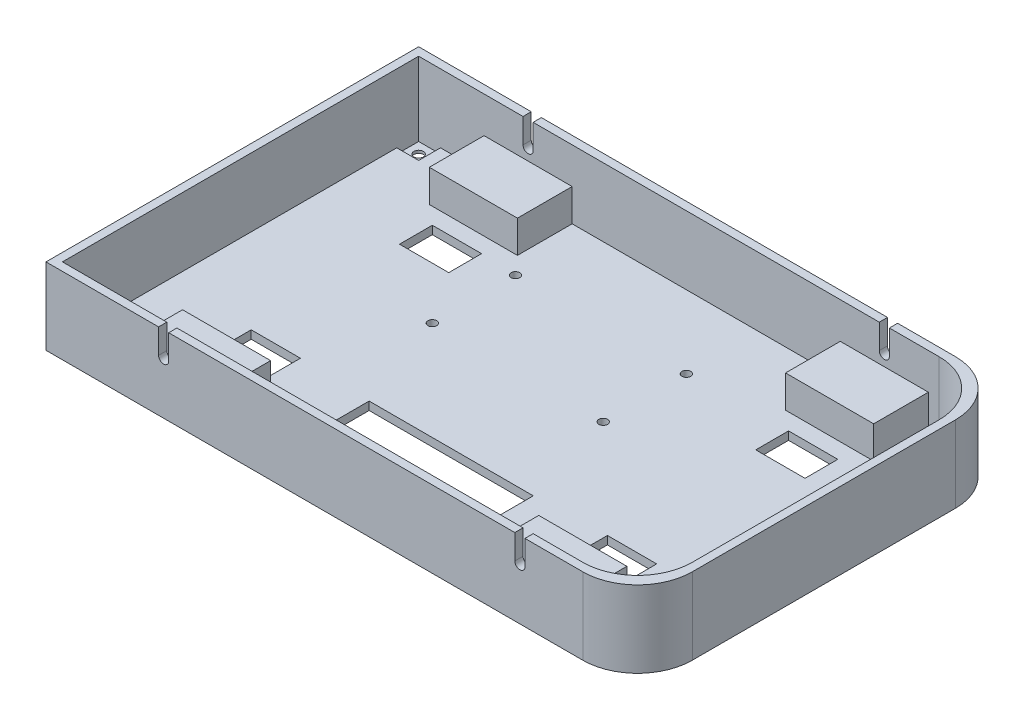
from build123d import *

# Parameters (mm, degrees)
SKETCH1_W                = 210.2
SKETCH1_H                = 130.2
BOSS_EXTRUDE1_DEPTH      = 3
FILLET1_R                = 20
BOSS_EXTRUDE3_DEPTH      = 25
BOSS_EXTRUDE3_DEPTH_BACK = 3
SKETCH2_W                = 216.2
SKETCH2_H                = 136.2
SKETCH2_W_2              = 210.2
SKETCH2_H_2              = 130.2
FILLET2_START            = -1
FILLET2_DEPTH            = 29
FILLET2_2_DEPTH          = 28
SKETCH5_W                = 32.2
SKETCH5_H                = 20
BOSS_EXTRUDE4_DEPTH      = 11.8
MIRROR2_COPY_1_SKETCH_W  = 32.2
MIRROR2_COPY_1_SKETCH_H  = 20
MIRROR2_COPY_1_DEPTH     = 11.8
SKETCH4_W                = 3.7
SKETCH4_H                = 167.196709826
SKETCH4_H_2              = 176.392528866
CUT_EXTRUDE1_DEPTH       = 9
CROQUIS1_R               = 1.75
CORTAR_EXTRUIR1_DEPTH    = 5
CROQUIS2_W               = 18
CROQUIS2_H               = 12
CROQUIS2_W_2             = 60
CORTAR_EXTRUIR2_DEPTH    = 5
CROQUIS3_W               = 8
CROQUIS3_H               = 8
CORTAR_EXTRUIR3_DEPTH    = 2
CORTAR_EXTRUIR4_DEPTH    = 150
CROQUIS5_R               = 1.6
CORTAR_EXTRUIR5_DEPTH    = 10


with BuildPart() as part:
    # Sketch1 → Boss-Extrude1 (new body)
    with BuildSketch(Plane(origin=(0, 0, 0), x_dir=(1, 0, 0), z_dir=(0, 1, 0))):
        Rectangle(SKETCH1_W, SKETCH1_H)
    extrude(amount=BOSS_EXTRUDE1_DEPTH)

    # Fillet1
    fillet1_edges = [part.edges().sort_by_distance(p)[0] for p in [
        (105.1, 1.5, 65.1),
        (105.1, 1.5, -65.1),
    ]]
    fillet(fillet1_edges, radius=FILLET1_R)

    # Sketch2 → Boss-Extrude3 (add, two sides: drawn at the far end of the back side and taken through both)
    with BuildSketch(Plane(origin=(0, 3, 0), x_dir=(1, 0, 0), z_dir=(0, 1, 0)).offset(-BOSS_EXTRUDE3_DEPTH_BACK)):
        Rectangle(SKETCH2_W, SKETCH2_H)
        Rectangle(SKETCH2_W_2, SKETCH2_H_2, mode=Mode.SUBTRACT)
    extrude(amount=BOSS_EXTRUDE3_DEPTH + BOSS_EXTRUDE3_DEPTH_BACK)

    # Fillet2: read off the stored shape, not the designer's step
    # Fillet2 outline → Fillet2 (cut)
    with BuildSketch(Plane(origin=(0, 0, 0), x_dir=(1, 0, 0), z_dir=(0, 1, 0)).offset(FILLET2_START)):
        with BuildLine():
            ThreePointArc((98.635653754, -65.1), (93.577225575, -67.335384062), (88.1, -68.1))
            Line((88.1, -68.1), (108.1, -68.1))
            Line((108.1, -68.1), (108.1, -48.1))
            ThreePointArc((108.1, -48.1), (107.335384062, -53.577225575), (105.1, -58.635653754))
            Line((105.1, -58.635653754), (105.1, -65.1))
            Line((105.1, -65.1), (98.635653754, -65.1))
        make_face()
        with BuildLine():
            ThreePointArc((105.1, 58.635653754), (107.335384062, 53.577225575), (108.1, 48.1))
            Line((108.1, 48.1), (108.1, 68.1))
            Line((108.1, 68.1), (88.1, 68.1))
            ThreePointArc((88.1, 68.1), (93.577225575, 67.335384062), (98.635653754, 65.1))
            Line((98.635653754, 65.1), (105.1, 65.1))
            Line((105.1, 65.1), (105.1, 58.635653754))
        make_face()
    extrude(amount=FILLET2_DEPTH, mode=Mode.SUBTRACT)

    # Fillet2 2 outline → Fillet2 2 (add)
    with BuildSketch(Plane(origin=(0, 0, 0), x_dir=(1, 0, 0), z_dir=(0, 1, 0))):
        with BuildLine():
            Line((85.1, -65.1), (98.635653754, -65.1))
            ThreePointArc((98.635653754, -65.1), (102.242135624, -62.242135624), (105.1, -58.635653754))
            Line((105.1, -58.635653754), (105.1, -45.1))
            ThreePointArc((105.1, -45.1), (99.242135624, -59.242135624), (85.1, -65.1))
        make_face()
        with BuildLine():
            ThreePointArc((85.1, 65.1), (99.242135624, 59.242135624), (105.1, 45.1))
            Line((105.1, 45.1), (105.1, 58.635653754))
            ThreePointArc((105.1, 58.635653754), (102.242135624, 62.242135624), (98.635653754, 65.1))
            Line((98.635653754, 65.1), (85.1, 65.1))
        make_face()
    extrude(amount=FILLET2_2_DEPTH)

    # Sketch5 → Boss-Extrude4 (add)
    with BuildSketch(Plane(origin=(0, 3, 0), x_dir=(1, 0, 0), z_dir=(0, 1, 0))):
        with Locations((-65.1, 55.1)):
            Rectangle(SKETCH5_W, SKETCH5_H)
    boss_extrude4 = extrude(amount=BOSS_EXTRUDE4_DEPTH)

    # Mirror1: Boss-Extrude4 across plane
    add(boss_extrude4.mirror(Plane(origin=(0, 0, 0), x_dir=(0, 0, 1), z_dir=(1, 0, 0))))

    # Mirror2: Boss-Extrude4 across plane
    add(boss_extrude4.mirror(Plane.XY))

    # Mirror2 copy 1 sketch → Mirror2 copy 1 (add)
    with BuildSketch(Plane(origin=(0, 3, 0), x_dir=(-1, 0, 0), z_dir=(0, 1, 0))):
        with Locations((-65.1, 55.1)):
            Rectangle(MIRROR2_COPY_1_SKETCH_W, MIRROR2_COPY_1_SKETCH_H)
    extrude(amount=MIRROR2_COPY_1_DEPTH)

    # Sketch4 → Cut-Extrude1 (cut)
    with BuildSketch(Plane(origin=(0, 28, 0), x_dir=(1, 0, 0), z_dir=(0, 1, 0))):
        with Locations((-65.1, 0)):
            Rectangle(SKETCH4_W, SKETCH4_H)
        with Locations((65.1, 0)):
            Rectangle(SKETCH4_W, SKETCH4_H_2)
    extrude(amount=-CUT_EXTRUDE1_DEPTH, mode=Mode.SUBTRACT)

    # Croquis1 → Cortar-Extruir1 (cut)
    with BuildSketch(Plane.XZ):
        with Locations(Location((-101.1, 61.1, 0), (0, 0, 270))):
            Circle(CROQUIS1_R)
        with Locations(Location((-101.1, -61.1, 0), (0, 0, 270))):
            Circle(CROQUIS1_R)
        with Locations(Location((96.1, 56.1, 0), (0, 0, 270))):
            Circle(CROQUIS1_R)
        with Locations(Location((96.1, -56.1, 0), (0, 0, 270))):
            Circle(CROQUIS1_R)
    extrude(amount=-CORTAR_EXTRUIR1_DEPTH, mode=Mode.SUBTRACT)

    # Croquis2 → Cortar-Extruir2 (cut)
    with BuildSketch(Plane(origin=(0, 3, 0), x_dir=(1, 0, 0), z_dir=(0, 1, 0))):
        with Locations((-65.1, 33.1)):
            Rectangle(CROQUIS2_W, CROQUIS2_H)
        with Locations((-65.1, -33.1)):
            Rectangle(CROQUIS2_W, CROQUIS2_H)
        with Locations((65.1, 33.1)):
            Rectangle(CROQUIS2_W, CROQUIS2_H)
        with Locations((65.1, -33.1)):
            Rectangle(CROQUIS2_W, CROQUIS2_H)
        with Locations((0, -34.1)):
            Rectangle(CROQUIS2_W_2, CROQUIS2_H)
    extrude(amount=-CORTAR_EXTRUIR2_DEPTH, mode=Mode.SUBTRACT)

    # Croquis3 → Cortar-Extruir3 (cut)
    with BuildSketch(Plane(origin=(0, 3, 0), x_dir=(1, 0, 0), z_dir=(0, 1, 0))):
        with BuildLine():
            Line((92.1, 60.1), (96.9, 60.1))
            ThreePointArc((96.9, 60.1), (99.1627417, 59.1627417), (100.1, 56.9))
            Line((100.1, 56.9), (100.1, 52.1))
            Line((100.1, 52.1), (92.1, 52.1))
            Line((92.1, 52.1), (92.1, 60.1))
        make_face()
        with Locations((-101.1, 61.1)):
            Rectangle(CROQUIS3_W, CROQUIS3_H)
        with Locations((-101.1, -61.1)):
            Rectangle(CROQUIS3_W, CROQUIS3_H)
        with BuildLine():
            Line((92.1, -52.1), (100.1, -52.1))
            Line((100.1, -52.1), (100.1, -56.9))
            ThreePointArc((100.1, -56.9), (99.1627417, -59.1627417), (96.9, -60.1))
            Line((96.9, -60.1), (92.1, -60.1))
            Line((92.1, -60.1), (92.1, -52.1))
        make_face()
    extrude(amount=-CORTAR_EXTRUIR3_DEPTH, mode=Mode.SUBTRACT)

    # Croquis4 → Cortar-Extruir4 (cut)
    with BuildSketch(Plane.XY.offset(68.1)):
        with BuildLine():
            Line((-66.95, 19), (-63.25, 19))
            ThreePointArc((-63.25, 19), (-65.1, 17.15), (-66.95, 19))
        make_face()
        with BuildLine():
            Line((66.95, 19), (63.25, 19))
            ThreePointArc((63.25, 19), (65.1, 17.15), (66.95, 19))
        make_face()
    extrude(amount=-CORTAR_EXTRUIR4_DEPTH, mode=Mode.SUBTRACT)

    # Croquis5 → Cortar-Extruir5 (cut)
    with BuildSketch(Plane.XZ):
        with Locations(Location((-43.1, -8.1, 0), (0, 0, 270))):
            Circle(CROQUIS5_R)
        with Locations(Location((-43.1, -38.48, 0), (0, 0, 270))):
            Circle(CROQUIS5_R)
        with Locations(Location((19.36, -8.1, 0), (0, 0, 270))):
            Circle(CROQUIS5_R)
        with Locations(Location((19.36, -38.48, 0), (0, 0, 270))):
            Circle(CROQUIS5_R)
    extrude(amount=-CORTAR_EXTRUIR5_DEPTH, mode=Mode.SUBTRACT)


solid = part.part
